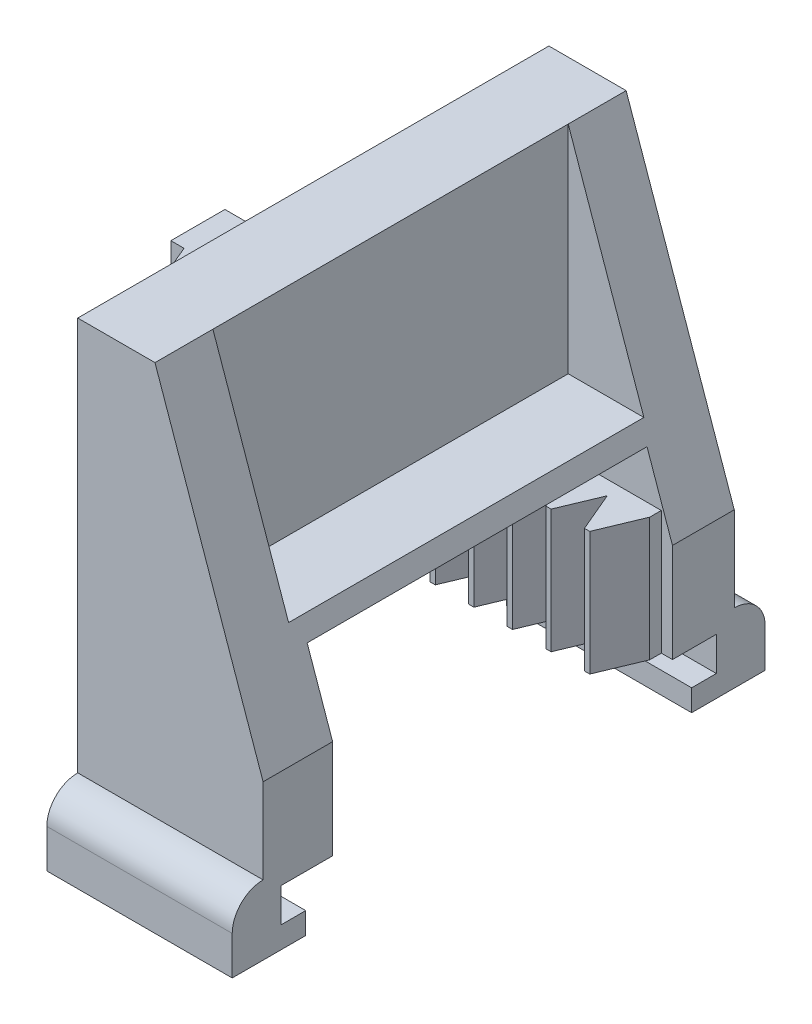
from build123d import *

# Parameters (mm, degrees)
BOSS_EXTRUDE1_DEPTH = 30.5
SKETCH4_W           = 22
SKETCH4_H           = 15
CUT_EXTRUDE2_DEPTH  = 25
CUT_EXTRUDE4_DEPTH  = 11.5
SKETCH7_W           = 31
SKETCH7_H           = 3.5
BOSS_EXTRUDE3_DEPTH = 8
BOSS_EXTRUDE4_START = -8
BOSS_EXTRUDE4_DEPTH = 8
LPATTERN1_COUNT     = 12
LPATTERN1_PITCH     = 2.5
SKETCH11_W          = 12
SKETCH11_H          = 4.5
BOSS_EXTRUDE5_DEPTH = 2
FILLET1_R           = 2
FILLET2_R           = 2
CUT_EXTRUDE5_DEPTH  = 49.427812959


with BuildPart() as part:
    # Sketch1 → Boss-Extrude1 (new body)
    with BuildSketch(Plane.XY):
        Polygon((0, 0), (0, -30), (12, -30), (12, -20), (5, 0), align=None)
    extrude(amount=-BOSS_EXTRUDE1_DEPTH)

    # Sketch4 → Cut-Extrude2 (cut)
    with BuildSketch(Plane.ZY):
        with Locations((-15.5, -22.788025353)):
            Rectangle(SKETCH4_W, SKETCH4_H)
    extrude(amount=-CUT_EXTRUDE2_DEPTH, mode=Mode.SUBTRACT)

    # Sketch6 → Cut-Extrude4 (cut, symmetric)
    with BuildSketch(Plane.XY.offset(-15.25)):
        Polygon((5, 0), (5, -14), (9.9, -14), align=None)
    extrude(amount=CUT_EXTRUDE4_DEPTH, both=True, mode=Mode.SUBTRACT)

    # Sketch7 → Boss-Extrude3 (add)
    with BuildSketch(Plane(origin=(0, -26.4, 0), x_dir=(1, 0, 0), z_dir=(0, 1, 0))):
        with Locations((-4.2231607, 27.5)):
            Rectangle(SKETCH7_W, SKETCH7_H)
    extrude(amount=BOSS_EXTRUDE3_DEPTH)

    # Sketch10 → Boss-Extrude4 (add)
    with BuildSketch(Plane(origin=(0, -18.4, 0), x_dir=(1, 0, 0), z_dir=(0, 1, 0)).offset(BOSS_EXTRUDE4_START)):
        Polygon((11.2768393, 25.75), (10.134695379, 23.01044295), (9.791251241, 23.01044295), (8.630940097, 25.75), align=None)
    boss_extrude4 = extrude(amount=BOSS_EXTRUDE4_DEPTH)

    # LPattern1: Boss-Extrude4 ×12
    with Locations(*[(-i * LPATTERN1_PITCH, 0, 0) for i in range(1, LPATTERN1_COUNT)]):
        add(boss_extrude4)

    # Sketch11 → Boss-Extrude5 (add)
    with BuildSketch(Plane(origin=(0, 0, -30.5), x_dir=(-1, 0, 0), z_dir=(0, 0, -1))):
        with Locations((-6, -27.75)):
            Rectangle(SKETCH11_W, SKETCH11_H)
    boss_extrude5 = extrude(amount=BOSS_EXTRUDE5_DEPTH)

    # Fillet1
    fillet1_edges = [part.edges().sort_by_distance(p)[0] for p in [
        (6, -25.5, -32.5),
    ]]
    fillet(fillet1_edges, radius=FILLET1_R - 0.0001)  # a hair under: the kernel refuses the full size

    # Mirror1: Boss-Extrude5 across plane
    add(boss_extrude5.mirror(Plane.XY.offset(-15.25)))

    # Fillet2
    fillet2_edges = [part.edges().sort_by_distance(p)[0] for p in [
        (6, -25.5, 2),
    ]]
    fillet(fillet2_edges, radius=FILLET2_R - 0.0001)  # a hair under: the kernel refuses the full size

    # Sketch9 → Cut-Extrude5 (cut, through all)
    with BuildSketch(Plane.ZY):
        Polygon((-6.15967028, -26.4), (-1.15967028, -26.4), (-1.15967028, -28.6), (-2.75967028, -28.6), (-2.75967028, -30.296685761), (-6.15967028, -30.296685761), align=None)
        Polygon((-27.74032972, -30.296685761), (-24.34032972, -30.296685761), (-24.34032972, -26.4), (-29.34032972, -26.4), (-29.34032972, -28.6), (-27.74032972, -28.6), align=None)
    extrude(amount=-CUT_EXTRUDE5_DEPTH, mode=Mode.SUBTRACT)


solid = part.part
